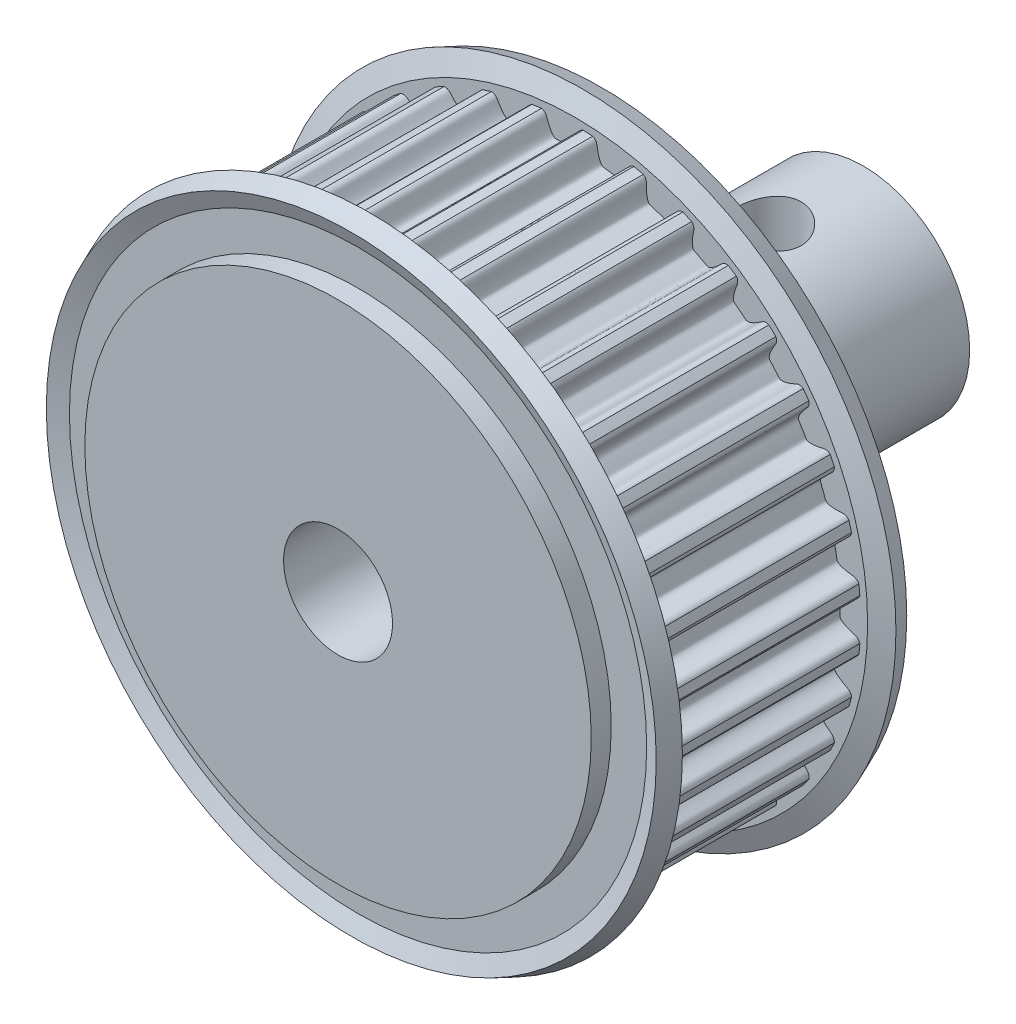
from build123d import *

# Parameters (mm, degrees)
TOOTHEXTRUDECUTGEARBELT01_DEPTH = 3.749999944
TOOTH_PATTERN_35_COUNT          = 35
BOREREVOLVESKETCH_W             = 10.547999842
BOREREVOLVESKETCH_H             = 5
SKETCH_5_R                      = 5
EXTRUDE_1_DEPTH                 = 10
SKETCH_6_R                      = 4.05
SKETCH_6_R_2                    = 2.05
EXTRUDE_2_DEPTH                 = 10
CUT_EXTRUDE_START               = -10
SKETCH_7_R                      = 2.05
CUT_EXTRUDE_2_DEPTH             = 10
EXTRUDE_3_DEPTH                 = 20
SKETCH_9_R                      = 1.25
CUT_EXTRUDE_6_DEPTH             = 24.198471801
CUT_EXTRUDE_9_DEPTH             = 27.141068878
SKETCH_11_R                     = 2.075
CUT_EXTRUDE_10_DEPTH            = 10


with BuildPart() as part:
    # SketchRevolveGearBelt01 → Gates_PowerGrip_GT_2mm, 6mm Belt Width (revolve)
    with BuildSketch(Plane(origin=(0, 0, 0), x_dir=(0, 0, -1), z_dir=(1, 0, 0))):
        Polygon((5.273999921, 0), (5.273999921, 9.640845872), (4.511999932, 9.640845872), (4.511999932, 10.989274627), (4.769626867, 11.611241067), (4.065630673, 11.902845838), (3.749999944, 11.140845849), (3.749999944, 10.872030033), (-3.749999944, 10.872030033), (-3.749999944, 11.140845849), (-4.065630673, 11.902845838), (-4.769626867, 11.611241067), (-4.511999932, 10.989274627), (-4.511999932, 9.640845872), (-5.273999921, 9.640845872), (-5.273999921, 0), align=None)
    revolve(axis=Axis((0, 0, 0), (0, 0, -1)))

    # SketchToothGearBelt01 → ToothExtrudeCutGearBelt01 (cut, symmetric)
    with BuildSketch(Plane.XY):
        with BuildLine():
            ThreePointArc((10.852064234, 0.862058304), (10.886250165, 0), (10.852064234, -0.862058304))
            add(Edge.make_bspline(
                [(10.852064234, -0.862058304), (10.852248096, -0.844642179), (10.849947295, -0.818492719), (10.841842285, -0.784572094), (10.833304572, -0.759848143), (10.822389407, -0.736077867), (10.809201587, -0.713489161), (10.793867489, -0.692298882), (10.776534448, -0.672709417), (10.757367683, -0.654911744), (10.736554766, -0.639064944), (10.71428128, -0.625364292), (10.690813148, -0.613779586), (10.653137038, -0.600389458), (10.604628452, -0.585707101), (10.547010566, -0.567480144), (10.494560937, -0.549825925), (10.445281416, -0.53218684), (10.399177233, -0.514546582), (10.356246021, -0.496909286), (10.316486972, -0.479273964), (10.279898494, -0.461640694), (10.246478674, -0.444008949), (10.216225019, -0.426377751), (10.189134503, -0.408745201), (10.165203298, -0.391107907), (10.144428104, -0.373460068), (10.126804032, -0.355792311), (10.112337539, -0.33809054), (10.101016773, -0.320336691), (10.0929309, -0.302512788), (10.087890137, -0.28461649), (10.085688892, -0.250312541), (10.088871159, -0.199994192), (10.089015214, -0.1333067), (10.089783746, -0.066656855), (10.089897818, 0), (10.089783746, 0.066656855), (10.089015214, 0.1333067), (10.088871159, 0.199994192), (10.085688892, 0.250312541), (10.087890137, 0.28461649), (10.0929309, 0.302512788), (10.101016773, 0.320336691), (10.112337539, 0.33809054), (10.126804032, 0.355792311), (10.144428104, 0.373460068), (10.165203298, 0.391107907), (10.189134503, 0.408745201), (10.216225019, 0.426377751), (10.246478674, 0.444008949), (10.279898494, 0.461640694), (10.316486972, 0.479273964), (10.356246021, 0.496909286), (10.399177233, 0.514546582), (10.445281416, 0.53218684), (10.494560937, 0.549825925), (10.547010566, 0.567480144), (10.604628452, 0.585707101), (10.653137038, 0.600389458), (10.690813148, 0.613779586), (10.71428128, 0.625364292), (10.736554766, 0.639064944), (10.757367683, 0.654911744), (10.776534448, 0.672709417), (10.793867489, 0.692298882), (10.809201587, 0.713489161), (10.822389407, 0.736077867), (10.833304572, 0.759848143), (10.841842285, 0.784572094), (10.849947295, 0.818492719), (10.852248096, 0.844642179), (10.852064234, 0.862058304)],
                knots=[0, 0, 0, 0, 0.020006147, 0.030009221, 0.040012294, 0.050015368, 0.060018441, 0.070021515, 0.080024588, 0.090027662, 0.100030735, 0.110033809, 0.120036882, 0.130039956, 0.15593293, 0.178284408, 0.199478937, 0.219523667, 0.238427048, 0.256199162, 0.272852143, 0.288400748, 0.302863113, 0.316261785, 0.328625135, 0.339989287, 0.350400774, 0.359920108, 0.368626423, 0.376623029, 0.384042937, 0.391052069, 0.397846505, 0.423403792, 0.448935862, 0.474467931, 0.5, 0.525532069, 0.551064138, 0.576596208, 0.602153495, 0.608947931, 0.615957063, 0.623376971, 0.631373577, 0.640079892, 0.649599226, 0.660010713, 0.671374865, 0.683738215, 0.697136887, 0.711599252, 0.727147857, 0.743800838, 0.761572952, 0.780476333, 0.800521063, 0.821715592, 0.84406707, 0.869960044, 0.879963118, 0.889966191, 0.899969265, 0.909972338, 0.919975412, 0.929978485, 0.939981559, 0.949984632, 0.959987706, 0.969990779, 0.979993853, 1, 1, 1, 1], degree=3))
        make_face()
    toothextrudecutgearbelt01 = extrude(amount=TOOTHEXTRUDECUTGEARBELT01_DEPTH, both=True, mode=Mode.SUBTRACT)

    # Tooth Pattern, 35: ToothExtrudeCutGearBelt01 ×35 about axis
    tooth_pattern_35_axis = Axis((0, 0, 55), (0, 0, -1))
    for i in range(1, TOOTH_PATTERN_35_COUNT):
        add(toothextrudecutgearbelt01.rotate(tooth_pattern_35_axis, i * 360 / TOOTH_PATTERN_35_COUNT), mode=Mode.SUBTRACT)

    # BoreRevolveSketch → BoreRevolveCut (revolve, cut)
    with BuildSketch(Plane(origin=(0, 0, 0), x_dir=(0, 0, -1), z_dir=(1, 0, 0))):
        with Locations((0, 2.5)):
            Rectangle(BOREREVOLVESKETCH_W, BOREREVOLVESKETCH_H)
    revolve(axis=Axis((0, 0, 0), (0, 0, -1)), mode=Mode.SUBTRACT)

    # 草图5 → 凸台-拉伸1 (add)
    with BuildSketch(Plane.XY.offset(5.273999921)):
        Circle(SKETCH_5_R)
    extrude(amount=-EXTRUDE_1_DEPTH)

    # 草图6 → 凸台-拉伸2 (add)
    with BuildSketch(Plane(origin=(0, 0, -4.726000079), x_dir=(-1, 0, 0), z_dir=(0, 0, -1))):
        Circle(SKETCH_6_R)
        Circle(SKETCH_6_R_2, mode=Mode.SUBTRACT)
    extrude(amount=EXTRUDE_2_DEPTH)

    # 草图7 → 切除-拉伸2 (cut)
    with BuildSketch(Plane(origin=(0, 0, -4.726000079), x_dir=(-1, 0, 0), z_dir=(0, 0, -1)).offset(CUT_EXTRUDE_START)):
        Circle(SKETCH_7_R)
    extrude(amount=CUT_EXTRUDE_2_DEPTH, mode=Mode.SUBTRACT)


with BuildPart() as body_2:
    # 草图8 → 凸台-拉伸3 (new body)
    with BuildSketch(Plane(origin=(0, 0, -14.726000079), x_dir=(-1, 0, 0), z_dir=(0, 0, -1))):
        with BuildLine():
            ThreePointArc((1.393142236, 1.5), (0, 2.047155414), (-1.393142236, 1.5))
            Line((-1.393142236, 1.5), (0, 1.5))
            Line((0, 1.5), (1.393142236, 1.5))
        make_face()
    extrude(amount=-EXTRUDE_3_DEPTH)


with BuildPart() as cut_extrude_6_tool:
    # 草图9 → 切除-拉伸6 (new, through all)
    with BuildSketch(Plane.XZ.offset(-1.5)):
        with Locations((0, -11.1094353)):
            Circle(SKETCH_9_R)
    extrude(amount=-CUT_EXTRUDE_6_DEPTH)


with BuildPart() as part_1:
    add(part.part)

    # 切除-拉伸6: cut by cut_extrude_6_tool
    add(cut_extrude_6_tool.part, mode=Mode.SUBTRACT)

    # 草图10 → 切除-拉伸9 (cut, through all)
    with BuildSketch(Plane(origin=(0, 0, -14.726000079), x_dir=(-1, 0, 0), z_dir=(0, 0, -1))):
        with BuildLine():
            Line((-1.397318861, 1.5), (-1.433745096, 1.5))
            ThreePointArc((-1.433745096, 1.5), (-0.815660446, -1.90796306), (2.075, 0))
            ThreePointArc((2.075, 0), (1.90796306, 0.815660446), (1.433745096, 1.5))
            Line((1.433745096, 1.5), (1.397318861, 1.5))
            ThreePointArc((1.397318861, 1.5), (1.879761111, 0.817923081), (2.05, 0))
            ThreePointArc((2.05, 0), (-0.817923081, -1.879761111), (-1.397318861, 1.5))
        make_face()
    extrude(amount=-CUT_EXTRUDE_9_DEPTH, mode=Mode.SUBTRACT)


with BuildPart() as body_2_1:
    add(body_2.part)

    # 切除-拉伸6: cut by cut_extrude_6_tool
    add(cut_extrude_6_tool.part, mode=Mode.SUBTRACT)


with BuildPart() as cut_extrude_10_tool:
    # 草图11 → 切除-拉伸10 (new body)
    with BuildSketch(Plane.XY.offset(5.273999921).offset(CUT_EXTRUDE_START)):
        Circle(SKETCH_11_R)
    extrude(amount=CUT_EXTRUDE_10_DEPTH)


with BuildPart() as part_2:
    add(part_1.part)

    # 切除-拉伸10: cut by cut_extrude_10_tool
    add(cut_extrude_10_tool.part, mode=Mode.SUBTRACT)


with BuildPart() as body_2_2:
    add(body_2_1.part)

    # 切除-拉伸10: cut by cut_extrude_10_tool
    add(cut_extrude_10_tool.part, mode=Mode.SUBTRACT)


solid = Compound([part_2.part, body_2_2.part])
